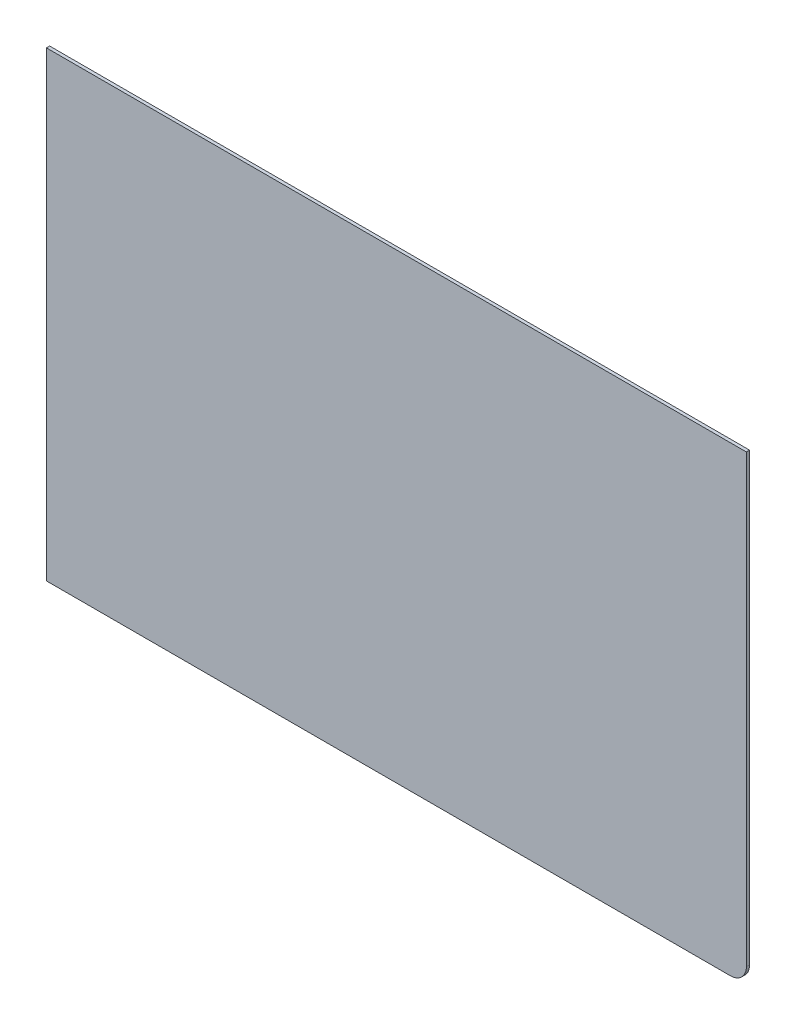
from build123d import *

# Parameters (mm, degrees)
SKETCH1_W           = 219.8
SKETCH1_H           = 144.9732
BASE_FLANGE1_DEPTH  = 1
BREAK_CORNER1_DEPTH = 1


# Read off the part's stored shape, not the designer's step: Break-Corner1
# Sheet-metal steps are written as plain solids
with BuildPart() as part:
    # Sketch1 → Base-Flange1 (new body)
    with BuildSketch(Plane.XY):
        with Locations((109.9, -79.9866)):
            Rectangle(SKETCH1_W, SKETCH1_H)
    extrude(amount=BASE_FLANGE1_DEPTH)

    # Break-Corner1 outline → Break-Corner1 (cut)
    with BuildSketch(Plane.XY):
        with BuildLine():
            Line((219.8, -152.4732), (219.8, -147.4732))
            ThreePointArc((219.8, -147.4732), (218.335533906, -151.008733906), (214.8, -152.4732))
            Line((214.8, -152.4732), (219.8, -152.4732))
        make_face()
    extrude(amount=BREAK_CORNER1_DEPTH, mode=Mode.SUBTRACT)


solid = part.part
